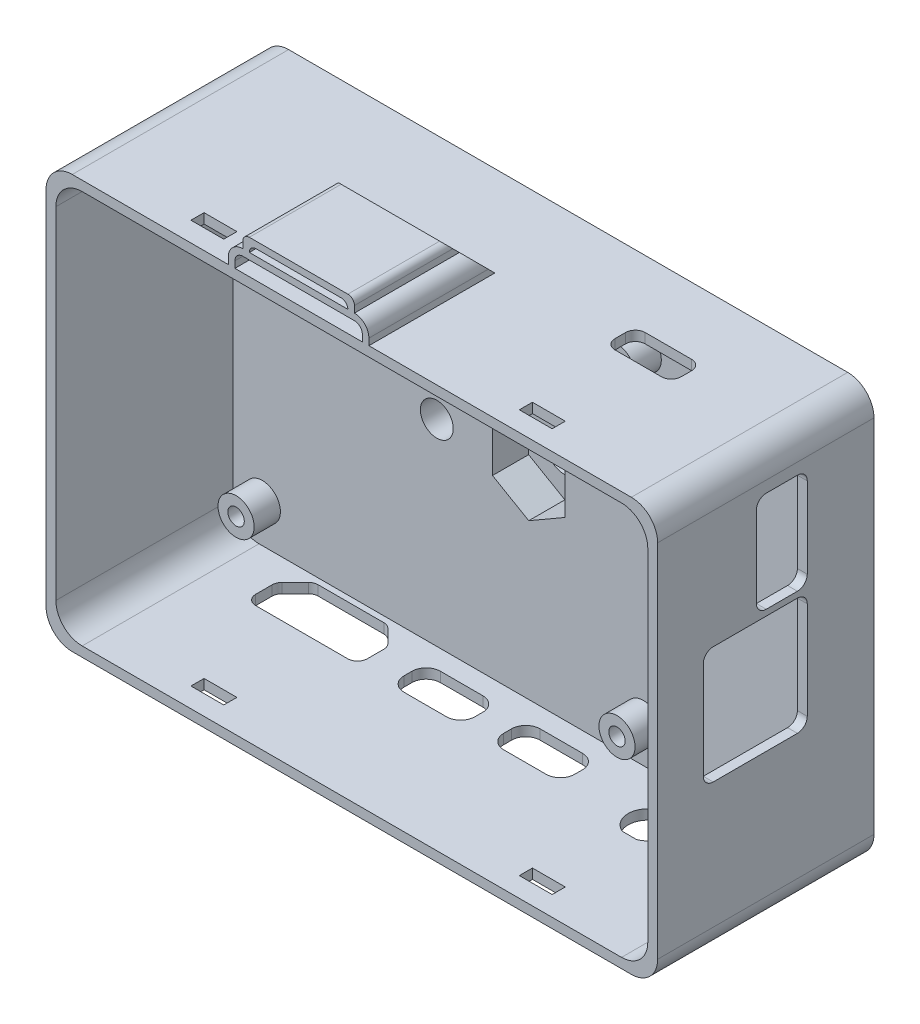
from build123d import *

# Parameters (mm, degrees)
SKETCH1_W           = 90.13
SKETCH1_H           = 59.92
BOSS_EXTRUDE1_DEPTH = 6
SKETCH5_R           = 2.75
SKETCH5_R_2         = 1.25
BOSS_EXTRUDE3_DEPTH = 4
SKETCH1_3_W         = 93.13
SKETCH1_3_H         = 62.92
SKETCH1_3_W_2       = 90.13
SKETCH1_3_H_2       = 59.92
BOSS_EXTRUDE2_DEPTH = 32.94
CUT_EXTRUDE1_REACH  = 86.925
CUT_EXTRUDE3_REACH  = 86.925
FILLET1_R           = 4
CUT_EXTRUDE5_REACH  = 105.672
BOSS_EXTRUDE4_START = -32.94
BOSS_EXTRUDE4_DEPTH = 19.18
CUT_EXTRUDE6_START  = -31.46
SKETCH8_W           = 5
SKETCH8_H           = 2
CUT_EXTRUDE6_DEPTH  = 1.5
CUT_EXTRUDE7_START  = 29.96
SKETCH8_2_W         = 5
SKETCH8_2_H         = 2
CUT_EXTRUDE7_DEPTH  = 1.5
FILLET2_R           = 1
CUT_EXTRUDE8_REACH  = 83.867
CUT_EXTRUDE9_DEPTH  = 5.5
CUT_EXTRUDE10_REACH = 67.1
SKETCH12_R          = 3.075
SKETCH12_R_2        = 2.5


with BuildPart() as part:
    # Sketch1 → Boss-Extrude1 (new body)
    with BuildSketch(Plane.XY):
        Rectangle(SKETCH1_W, SKETCH1_H)
    extrude(amount=BOSS_EXTRUDE1_DEPTH)

    # Sketch5 → Boss-Extrude3 (add)
    # profile 1 of 4: a face of its own
    with BuildSketch(Plane.XY.offset(6)):
        with Locations(Location((-40.565, 24.89, 0), (0, 0, 180))):
            Circle(SKETCH5_R)
        with Locations((-40.565, 24.89)):
            Circle(SKETCH5_R_2, mode=Mode.SUBTRACT)
    # profile 2 of 4: a face of its own
    with BuildSketch(Plane.XY.offset(6)):
        with Locations(Location((17.435, 24.89, 0), (0, 0, 180))):
            Circle(SKETCH5_R)
        with Locations((17.435, 24.89)):
            Circle(SKETCH5_R_2, mode=Mode.SUBTRACT)
    # profile 3 of 4: a face of its own
    with BuildSketch(Plane.XY.offset(6)):
        with Locations(Location((17.435, -24.11, 0), (0, 0, 180))):
            Circle(SKETCH5_R)
        with Locations((17.435, -24.11)):
            Circle(SKETCH5_R_2, mode=Mode.SUBTRACT)
    # profile 4 of 4: a face of its own
    with BuildSketch(Plane.XY.offset(6)):
        with Locations(Location((-40.565, -24.11, 0), (0, 0, 180))):
            Circle(SKETCH5_R)
        with Locations((-40.565, -24.11)):
            Circle(SKETCH5_R_2, mode=Mode.SUBTRACT)
    extrude(amount=BOSS_EXTRUDE3_DEPTH)

    # Sketch1<3> → Boss-Extrude2 (add)
    with BuildSketch(Plane.XY):
        Rectangle(SKETCH1_3_W, SKETCH1_3_H)
        Rectangle(SKETCH1_3_W_2, SKETCH1_3_H_2, mode=Mode.SUBTRACT)
    extrude(amount=BOSS_EXTRUDE2_DEPTH)

    # Sketch3 → Cut-Extrude1 (cut, up to next)
    with BuildSketch(Plane.XZ.offset(31.46), mode=Mode.PRIVATE) as cut_extrude1_sk1:
        with BuildLine():
            Line((-19.165, 14.41), (-33.165, 14.41))
            ThreePointArc((-33.165, 14.41), (-34.225660172, 13.970660172), (-34.665, 12.91))
            Line((-34.665, 12.91), (-34.665, 10.407106781))
            ThreePointArc((-34.665, 10.407106781), (-34.550819299, 9.833081633), (-34.225660172, 9.346446609))
            Line((-34.225660172, 9.346446609), (-32.218553391, 7.339339828))
            ThreePointArc((-32.218553391, 7.339339828), (-31.731918367, 7.014180701), (-31.157893219, 6.9))
            Line((-31.157893219, 6.9), (-21.172106781, 6.9))
            ThreePointArc((-21.172106781, 6.9), (-20.598081633, 7.014180701), (-20.111446609, 7.339339828))
            Line((-20.111446609, 7.339339828), (-18.104339828, 9.346446609))
            ThreePointArc((-18.104339828, 9.346446609), (-17.779180701, 9.833081633), (-17.665, 10.407106781))
            Line((-17.665, 10.407106781), (-17.665, 12.91))
            ThreePointArc((-17.665, 12.91), (-18.104339828, 13.970660172), (-19.165, 14.41))
        make_face()
    cut_extrude1_tool1 = extrude(cut_extrude1_sk1.sketch, amount=-CUT_EXTRUDE1_REACH, mode=Mode.PRIVATE) & part.part
    # Sketch3 → Cut-Extrude1 (cut, up to next)
    with BuildSketch(Plane.XZ.offset(31.46), mode=Mode.PRIVATE) as cut_extrude1_sk2:
        with BuildLine():
            Line((-10.455, 9), (-3.995, 9))
            ThreePointArc((-3.995, 9), (-2.460578285, 9.635578285), (-1.825, 11.17))
            Line((-1.825, 11.17), (-1.825, 12.37))
            ThreePointArc((-1.825, 12.37), (-2.460578285, 13.904421715), (-3.995, 14.54))
            Line((-3.995, 14.54), (-10.455, 14.54))
            ThreePointArc((-10.455, 14.54), (-11.989421715, 13.904421715), (-12.625, 12.37))
            Line((-12.625, 12.37), (-12.625, 11.17))
            ThreePointArc((-12.625, 11.17), (-11.989421715, 9.635578285), (-10.455, 9))
        make_face()
    cut_extrude1_tool2 = extrude(cut_extrude1_sk2.sketch, amount=-CUT_EXTRUDE1_REACH, mode=Mode.PRIVATE) & part.part
    # Sketch3 → Cut-Extrude1 (cut, up to next)
    with BuildSketch(Plane.XZ.offset(31.46), mode=Mode.PRIVATE) as cut_extrude1_sk3:
        with BuildLine():
            Line((13.355, 11.17), (13.355, 12.37))
            ThreePointArc((13.355, 12.37), (12.719421715, 13.904421715), (11.185, 14.54))
            Line((11.185, 14.54), (4.725, 14.54))
            ThreePointArc((4.725, 14.54), (3.190578285, 13.904421715), (2.555, 12.37))
            Line((2.555, 12.37), (2.555, 11.17))
            ThreePointArc((2.555, 11.17), (3.190578285, 9.635578285), (4.725, 9))
            Line((4.725, 9), (11.185, 9))
            ThreePointArc((11.185, 9), (12.719421715, 9.635578285), (13.355, 11.17))
        make_face()
    cut_extrude1_tool3 = extrude(cut_extrude1_sk3.sketch, amount=-CUT_EXTRUDE1_REACH, mode=Mode.PRIVATE) & part.part
    # Sketch3 → Cut-Extrude1 (cut, up to next)
    with BuildSketch(Plane.XZ.offset(31.46), mode=Mode.PRIVATE) as cut_extrude1_sk4:
        with BuildLine():
            Line((26.677032961, 16.26), (24.522967039, 16.26))
            ThreePointArc((24.522967039, 16.26), (22.6, 13.46), (24.522967039, 10.66))
            Line((24.522967039, 10.66), (26.677032961, 10.66))
            ThreePointArc((26.677032961, 10.66), (28.6, 13.46), (26.677032961, 16.26))
        make_face()
    cut_extrude1_tool4 = extrude(cut_extrude1_sk4.sketch, amount=-CUT_EXTRUDE1_REACH, mode=Mode.PRIVATE) & part.part
    # Sketch3 → Cut-Extrude1 (cut, up to next)
    with BuildSketch(Plane.XZ.offset(31.46), mode=Mode.PRIVATE) as cut_extrude1_sk5:
        with BuildLine():
            Line((37.1, 7), (23.1, 7))
            ThreePointArc((23.1, 7), (22.746446609, 7.146446609), (22.6, 7.5))
            Line((22.6, 7.5), (22.6, 9.5))
            ThreePointArc((22.6, 9.5), (22.746446609, 9.853553391), (23.1, 10))
            Line((23.1, 10), (37.1, 10))
            ThreePointArc((37.1, 10), (37.453553391, 9.853553391), (37.6, 9.5))
            Line((37.6, 9.5), (37.6, 7.5))
            ThreePointArc((37.6, 7.5), (37.453553391, 7.146446609), (37.1, 7))
        make_face()
    cut_extrude1_tool5 = extrude(cut_extrude1_sk5.sketch, amount=-CUT_EXTRUDE1_REACH, mode=Mode.PRIVATE) & part.part
    add(cut_extrude1_tool1.solids().sort_by_distance((-26.165, -31.46, 10.827552))[0], mode=Mode.SUBTRACT)
    add(cut_extrude1_tool2.solids().sort_by_distance((-7.225, -31.46, 11.77))[0], mode=Mode.SUBTRACT)
    add(cut_extrude1_tool3.solids().sort_by_distance((7.955, -31.46, 11.77))[0], mode=Mode.SUBTRACT)
    add(cut_extrude1_tool4.solids().sort_by_distance((25.6, -31.46, 13.46))[0], mode=Mode.SUBTRACT)
    add(cut_extrude1_tool5.solids().sort_by_distance((30.1, -31.46, 8.5))[0], mode=Mode.SUBTRACT)

    # Sketch4 → Cut-Extrude3 (cut, up to next)
    with BuildSketch(Plane(origin=(0, 31.46, 0), x_dir=(1, 0, 0), z_dir=(0, 1, 0)), mode=Mode.PRIVATE) as cut_extrude3_sk1:
        with BuildLine():
            Line((21.895, -14.76), (28.965, -14.76))
            ThreePointArc((28.965, -14.76), (30.025660172, -14.320660172), (30.465, -13.26))
            Line((30.465, -13.26), (30.465, -11.66))
            ThreePointArc((30.465, -11.66), (30.025660172, -10.599339828), (28.965, -10.16))
            Line((28.965, -10.16), (21.895, -10.16))
            ThreePointArc((21.895, -10.16), (20.834339828, -10.599339828), (20.395, -11.66))
            Line((20.395, -11.66), (20.395, -13.26))
            ThreePointArc((20.395, -13.26), (20.834339828, -14.320660172), (21.895, -14.76))
        make_face()
    cut_extrude3_tool1 = extrude(cut_extrude3_sk1.sketch, amount=-CUT_EXTRUDE3_REACH, mode=Mode.PRIVATE) & part.part
    add(cut_extrude3_tool1.solids().sort_by_distance((25.43, 31.46, 12.46))[0], mode=Mode.SUBTRACT)

    # Fillet1
    fillet1_edges = [part.edges().sort_by_distance(p)[0] for p in [
        (-45.065, 29.96, 19.47),
        (45.065, 29.96, 19.47),
        (45.065, -29.96, 19.47),
        (-45.065, -29.96, 19.47),
        (-46.565, 31.46, 16.47),
        (46.565, 31.46, 16.47),
        (46.565, -31.46, 16.47),
        (-46.565, -31.46, 16.47),
    ]]
    fillet(fillet1_edges, radius=FILLET1_R)

    # Sketch6 → Cut-Extrude5 (cut, up to next)
    with BuildSketch(Plane(origin=(46.565, 0, 0), x_dir=(0, 0, -1), z_dir=(1, 0, 0)), mode=Mode.PRIVATE) as cut_extrude5_sk1:
        with BuildLine():
            Line((-11.66, 9.52), (-24.49, 9.52))
            ThreePointArc((-24.49, 9.52), (-25.550660172, 9.080660172), (-25.99, 8.02))
            Line((-25.99, 8.02), (-25.99, -6.81))
            ThreePointArc((-25.99, -6.81), (-25.550660172, -7.870660172), (-24.49, -8.31))
            Line((-24.49, -8.31), (-11.66, -8.31))
            ThreePointArc((-11.66, -8.31), (-10.599339828, -7.870660172), (-10.16, -6.81))
            Line((-10.16, -6.81), (-10.16, 8.02))
            ThreePointArc((-10.16, 8.02), (-10.599339828, 9.080660172), (-11.66, 9.52))
        make_face()
    cut_extrude5_tool1 = extrude(cut_extrude5_sk1.sketch, amount=-CUT_EXTRUDE5_REACH, mode=Mode.PRIVATE) & part.part
    # Sketch6 → Cut-Extrude5 (cut, up to next)
    with BuildSketch(Plane(origin=(46.565, 0, 0), x_dir=(0, 0, -1), z_dir=(1, 0, 0)), mode=Mode.PRIVATE) as cut_extrude5_sk2:
        with BuildLine():
            Line((-11.66, 25.73), (-16.41, 25.73))
            ThreePointArc((-16.41, 25.73), (-17.470660172, 25.290660172), (-17.91, 24.23))
            Line((-17.91, 24.23), (-17.91, 11.93))
            ThreePointArc((-17.91, 11.93), (-17.470660172, 10.869339828), (-16.41, 10.43))
            Line((-16.41, 10.43), (-11.66, 10.43))
            ThreePointArc((-11.66, 10.43), (-10.599339828, 10.869339828), (-10.16, 11.93))
            Line((-10.16, 11.93), (-10.16, 24.23))
            ThreePointArc((-10.16, 24.23), (-10.599339828, 25.290660172), (-11.66, 25.73))
        make_face()
    cut_extrude5_tool2 = extrude(cut_extrude5_sk2.sketch, amount=-CUT_EXTRUDE5_REACH, mode=Mode.PRIVATE) & part.part
    add(cut_extrude5_tool1.solids().sort_by_distance((46.565, 0.605, 18.075))[0], mode=Mode.SUBTRACT)
    add(cut_extrude5_tool2.solids().sort_by_distance((46.565, 18.08, 14.035))[0], mode=Mode.SUBTRACT)

    # Sketch7 → Boss-Extrude4 (add)
    with BuildSketch(Plane(origin=(0, 0, 0), x_dir=(-1, 0, 0), z_dir=(0, 0, -1)).offset(BOSS_EXTRUDE4_START)):
        with BuildLine():
            Line((17.805, 31.46), (18.805, 31.46))
            Line((18.805, 31.46), (18.805, 32.46))
            ThreePointArc((18.805, 32.46), (18.160634919, 34.015634919), (16.605, 34.66))
            Line((16.605, 34.66), (15.605, 34.66))
            Line((15.605, 34.66), (0.605, 34.66))
            Line((0.605, 34.66), (-0.395, 34.66))
            ThreePointArc((-0.395, 34.66), (-1.950634919, 34.015634919), (-2.595, 32.46))
            Line((-2.595, 32.46), (-2.595, 31.46))
            Line((-2.595, 31.46), (-1.595, 31.46))
            Line((-1.595, 31.46), (-1.595, 32.46))
            ThreePointArc((-1.595, 32.46), (-1.243528137, 33.308528137), (-0.395, 33.66))
            Line((-0.395, 33.66), (16.605, 33.66))
            ThreePointArc((16.605, 33.66), (17.453528137, 33.308528137), (17.805, 32.46))
            Line((17.805, 32.46), (17.805, 31.46))
        make_face()
        Polygon((15.605, 34.66), (16.605, 34.66), (16.605, 36.66), (-0.395, 36.66), (-0.395, 34.66), (0.605, 34.66), (0.605, 35.66), (15.605, 35.66), align=None)
    extrude(amount=BOSS_EXTRUDE4_DEPTH)

    # Sketch8 → Cut-Extrude6 (cut)
    with BuildSketch(Plane(origin=(0, 0, 0), x_dir=(1, 0, 0), z_dir=(0, 1, 0)).offset(CUT_EXTRUDE6_START)):
        with Locations((-25, -28.94)):
            Rectangle(SKETCH8_W, SKETCH8_H)
        with Locations((25, -28.94)):
            Rectangle(SKETCH8_W, SKETCH8_H)
    extrude(amount=CUT_EXTRUDE6_DEPTH, mode=Mode.SUBTRACT)

    # Sketch8<2> → Cut-Extrude7 (cut)
    with BuildSketch(Plane(origin=(0, 0, 0), x_dir=(1, 0, 0), z_dir=(0, 1, 0)).offset(CUT_EXTRUDE7_START)):
        with Locations((-25, -28.94)):
            Rectangle(SKETCH8_2_W, SKETCH8_2_H)
        with Locations((25, -28.94)):
            Rectangle(SKETCH8_2_W, SKETCH8_2_H)
    extrude(amount=CUT_EXTRUDE7_DEPTH, mode=Mode.SUBTRACT)

    # Fillet2
    fillet2_edges = [part.edges().sort_by_distance(p)[0] for p in [
        (-15.605, 35.66, 23.35),
        (-0.605, 35.66, 23.35),
    ]]
    fillet(fillet2_edges, radius=FILLET2_R - 0.0001)  # a hair under: the kernel refuses the full size
    fillet2_2_edges = [part.edges().sort_by_distance(p)[0] for p in [
        (0.395, 36.66, 23.35),
        (-16.605, 36.66, 23.35),
    ]]
    fillet(fillet2_2_edges, radius=FILLET2_R)

    # Cut-Extrude8: up to this face of the body (flat: up to its plane)
    cut_extrude8_end = Plane(part.part.faces().sort_by_distance((2.595, 31.96, 23.35))[0])
    # Sketch10 → Cut-Extrude8 (cut, up to the picked face)
    with BuildSketch(Plane.ZY.offset(18.805), mode=Mode.PRIVATE) as cut_extrude8_sk1:
        Polygon((13.76, 36.66), (18.96, 36.66), (13.76, 31.46), align=None)
    cut_extrude8_tool1 = split(extrude(cut_extrude8_sk1.sketch, amount=-CUT_EXTRUDE8_REACH, mode=Mode.PRIVATE), bisect_by=cut_extrude8_end, keep=Keep.BOTH, mode=Mode.PRIVATE)
    add(cut_extrude8_tool1.solids().sort_by(Axis((-18.805, 34.926667, 15.493333), (1, 0, 0)))[0], mode=Mode.SUBTRACT)

    # Sketch11 → Cut-Extrude9 (cut)
    with BuildSketch(Plane(origin=(0, 0, 6), x_dir=(-1, 0, 0), z_dir=(0, 0, -1))):
        Polygon((0, 6.379720475), (-5.525, 3.189860237), (-5.525, -3.189860237), (0, -6.379720475), (5.525, -3.189860237), (5.525, 3.189860237), align=None)
    extrude(amount=CUT_EXTRUDE9_DEPTH, mode=Mode.SUBTRACT)

    # Sketch12 → Cut-Extrude10 (cut, up to next)
    with BuildSketch(Plane.XY.offset(6), mode=Mode.PRIVATE) as cut_extrude10_sk1:
        Circle(SKETCH12_R)
    cut_extrude10_tool1 = extrude(cut_extrude10_sk1.sketch, amount=-CUT_EXTRUDE10_REACH, mode=Mode.PRIVATE) & part.part
    # Sketch12 → Cut-Extrude10 (cut, up to next)
    with BuildSketch(Plane.XY.offset(6), mode=Mode.PRIVATE) as cut_extrude10_sk2:
        with Locations((-14, 0)):
            Circle(SKETCH12_R_2)
    cut_extrude10_tool2 = extrude(cut_extrude10_sk2.sketch, amount=-CUT_EXTRUDE10_REACH, mode=Mode.PRIVATE) & part.part
    add(cut_extrude10_tool1.solids().sort_by_distance((0, 0, 6))[0], mode=Mode.SUBTRACT)
    add(cut_extrude10_tool2.solids().sort_by_distance((-14, 0, 6))[0], mode=Mode.SUBTRACT)


solid = part.part
